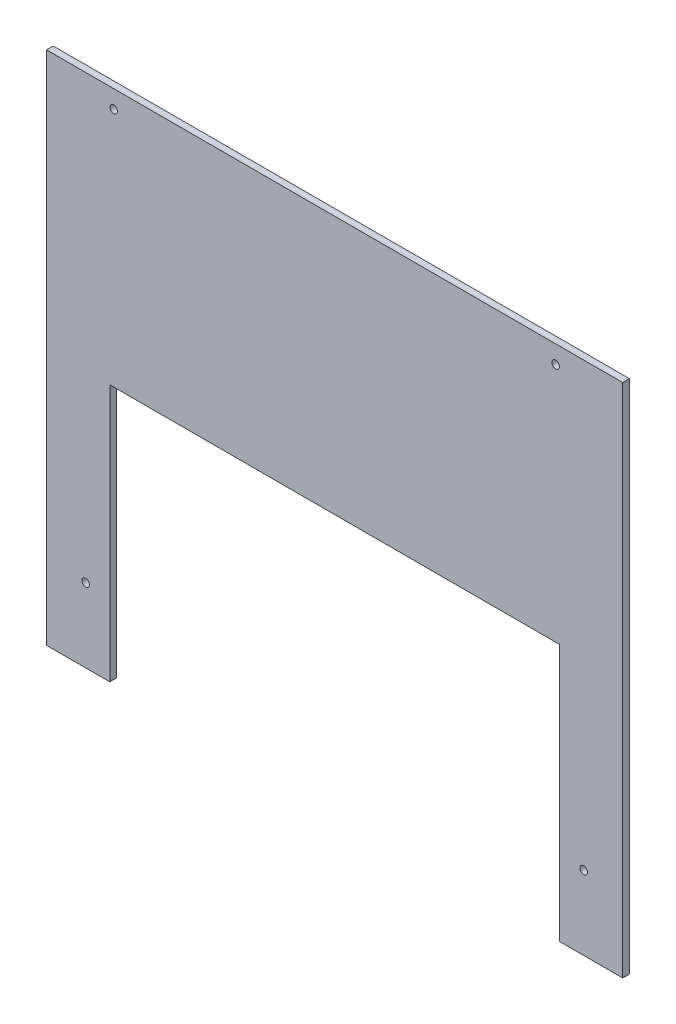
from build123d import *

# Parameters (mm, degrees)
ESQUISSE2_R        = 1.7
BOSS_EXTRU_1_DEPTH = 3


with BuildPart() as part:
    # Esquisse2 → Boss.-Extru.1 (new body)
    with BuildSketch(Plane.XY):
        Polygon((229.255, -230.48), (257.51, -230.48), (257.51, 0), (0, 0), (0, -230.48), (28.255, -230.48), (28.255, -115.48), (229.255, -115.48), align=None)
        with Locations((17.455, -197.48)):
            Circle(ESQUISSE2_R, mode=Mode.SUBTRACT)
        with Locations((240.055, -197.48)):
            Circle(ESQUISSE2_R, mode=Mode.SUBTRACT)
        with Locations((227.51, -8)):
            Circle(ESQUISSE2_R, mode=Mode.SUBTRACT)
        with Locations((30, -8)):
            Circle(ESQUISSE2_R, mode=Mode.SUBTRACT)
    extrude(amount=BOSS_EXTRU_1_DEPTH)


solid = part.part
